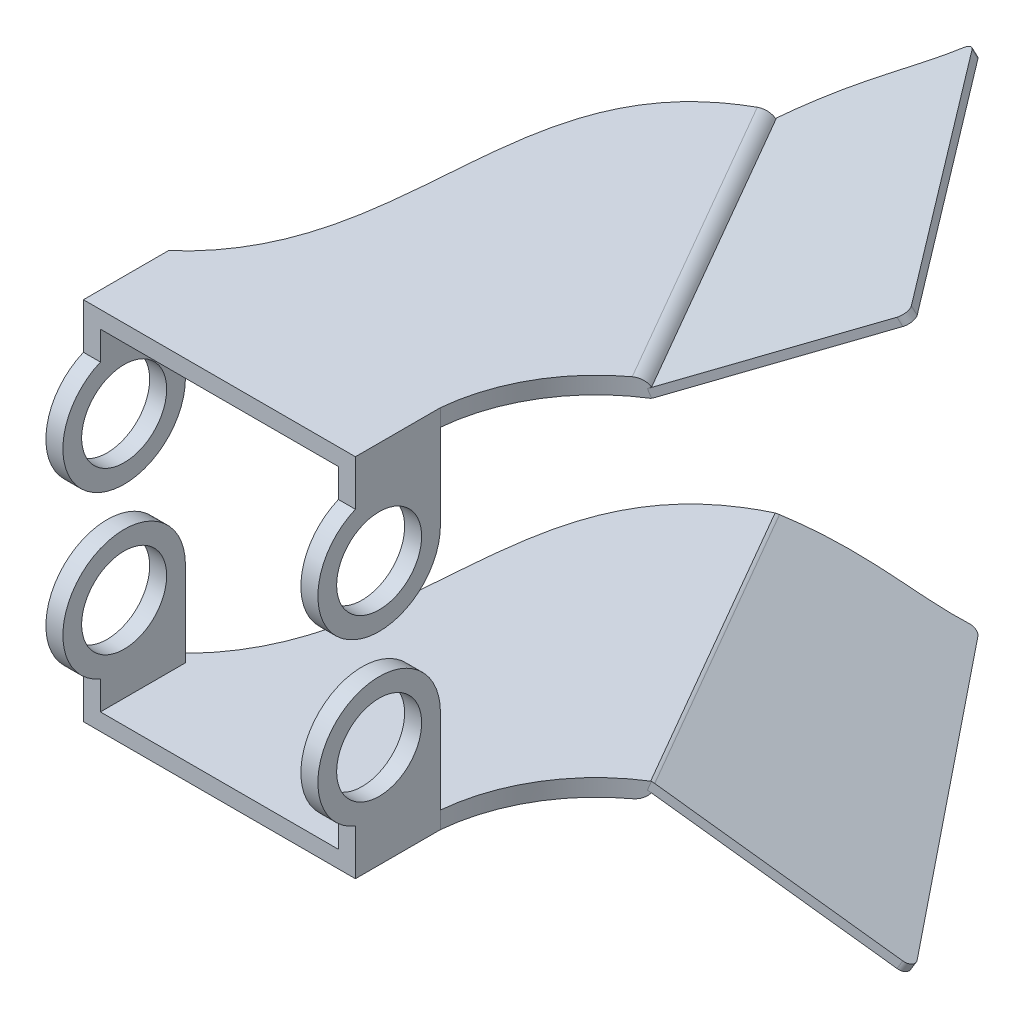
from build123d import *

# Parameters (mm, degrees)
EXTRUDE_1_DEPTH     = 2
SKETCH_2_R          = 5
EXTRUDE_2_DEPTH     = 16
SKETCH_6_W          = 28
SKETCH_6_H          = 17.402719954
CUT_EXTRUDE_1_DEPTH = 52.997949028
EXTRUDE_3_DEPTH     = 1
FILLET_2_R          = 2
FILLET_3_R          = 2
SKETCH_8_R          = 5.82594274
EXTRUDE_4_DEPTH     = 25
SKETCH_9_W          = 11.65188548
SKETCH_9_H          = 25
CUT_EXTRUDE_2_DEPTH = 22
SKETCH_11_R         = 5.664171458
EXTRUDE_5_DEPTH     = 40
SKETCH_12_W         = 11.328342916
SKETCH_12_H         = 39
CUT_EXTRUDE_3_DEPTH = 20
SKETCH_12_2_W       = 11.328342916
SKETCH_12_2_H       = 39
CUT_EXTRUDE_4_DEPTH = 10


with BuildPart() as part:
    # 草图1 → 凸台-拉伸1 (new body)
    with BuildSketch(Plane(origin=(0, 0, 0), x_dir=(1, 0, 0), z_dir=(0, 1, 0))):
        with BuildLine():
            Line((-33.243243243, -24.932432432), (-1.243243243, -24.932432432))
            Line((-1.243243243, -24.932432432), (-1.243243243, -14.932432432))
            ThreePointArc((-1.243243243, -14.932432432), (1.697148643, -6.13940818), (8.243243243, 0.426551416))
            Line((8.243243243, 0.426551416), (-11.756756757, 35.067567568))
            add(Edge.make_bspline(
                [(-33.243243243, -14.932432432), (-17.547932251, -1.015151266), (-32.626133519, 25.165131833), (-11.756756757, 35.067567568)],
                knots=[0, 0, 0, 0, 1, 1, 1, 1], degree=3))
            Line((-33.243243243, -14.932432432), (-33.243243243, -24.932432432))
        make_face()
    extrude(amount=EXTRUDE_1_DEPTH)

    # 草图2 → 凸台-拉伸2 (add, symmetric)
    with BuildSketch(Plane.ZY.offset(17.243243243)):
        with BuildLine():
            Line((14.932432432, 2), (14.932432432, 12))
            ThreePointArc((14.932432432, 12), (26.129367198, 18.003244699), (24.932432432, 5.355017858))
            Line((24.932432432, 5.355017858), (24.932432432, 2))
            Line((24.932432432, 2), (14.932432432, 2))
        make_face()
        with Locations((22.140221816, 12)):
            Circle(SKETCH_2_R, mode=Mode.SUBTRACT)
    extrude(amount=EXTRUDE_2_DEPTH, both=True)

    # 草图6 → 切除-拉伸1 (cut, through all)
    with BuildSketch(Plane.XY):
        with Locations((-17.243243243, 10.701359977)):
            Rectangle(SKETCH_6_W, SKETCH_6_H)
    extrude(amount=CUT_EXTRUDE_1_DEPTH, mode=Mode.SUBTRACT)

    # 草图7 → 凸台-拉伸3 (add)
    with BuildSketch(Plane(origin=(2.341783653, 4.683567307, -1.352029423), x_dir=(0.49999999999999495, 0, 0.8660254037844416), z_dir=(0.43301270189222174, 0.866025403784438, -0.24999999999999803))):
        with BuildLine():
            Line((-36.994807064, 25.214344641), (4.684167628, 32.070006247))
            ThreePointArc((4.684167628, 32.070006247), (5.524135177, 31.818639991), (5.843163839, 31.001969195))
            Line((5.843163839, 31.001969195), (3.752217259, 5.367134614))
            Line((3.752217259, 5.367134614), (3.752217259, 5.300961696))
            Line((3.752217259, 5.300961696), (-36.253180241, 5.300961696))
            Line((-36.253180241, 5.300961696), (-36.247782741, 5.367134614))
            add(Edge.make_bspline(
                [(-36.247782741, 5.367134614), (-38.690167695, 13.725474556), (-37.064789312, 18.95114602), (-37.821789964, 24.081635177)],
                knots=[0, 0, 0, 0, 0.95157929, 0.95157929, 0.95157929, 0.95157929], degree=3))
            ThreePointArc((-37.821789964, 24.081635177), (-37.640152143, 24.817264549), (-36.994807064, 25.214344641))
        make_face()
    extrude(amount=-EXTRUDE_3_DEPTH)

    # 圆角2
    # the kernel refuses this fillet: 2 mm, written as the material it takes off along each edge
    with BuildSketch(Plane(origin=(10.284484696, 0, 3.10898249), x_dir=(-0.8660254037844416, 0, 0.49999999999999495), z_dir=(-0.49999999999999495, 0, -0.8660254037844416))) as fillet_2_piece_1:
        with BuildLine():
            CenterArc((1.632993162, 2), FILLET_2_R, 215.264389683, 54.735610317)
            Line((0, 0.845299462), (-0.032659863, 0.822205451))
            ThreePointArc((-0.032659863, 0.822205451), (-0.04, 0.422649731), (-0.04, 0))
            Line((-0.04, 0), (0, -0.04))
            Line((0, -0.04), (1.632993162, -0.04))
            Line((1.632993162, -0.04), (1.632993162, 0))
        make_face()
    extrude(amount=48.164965809, mode=Mode.SUBTRACT)

    # 圆角3
    # the kernel refuses this fillet: 2 mm, written as the material it takes off along each edge
    with BuildSketch(Plane(origin=(8.679926515, 2.033086459, 0.444421053), x_dir=(0.7500000000000034, -0.499999999999998, -0.4330127018922155), z_dir=(-0.49999999999999495, 0, -0.8660254037844416))) as fillet_3_piece_1:
        with BuildLine():
            CenterArc((0.389050368, 2), FILLET_3_R, 258.783012488, 11.216987512)
            Line((0, 0.038204952), (-0.007781007, -0.001030949))
            ThreePointArc((-0.007781007, -0.001030949), (-0.04, 0.019102476), (-0.04, 0))
            Line((-0.04, 0), (0, -0.04))
            Line((0, -0.04), (0.389050368, -0.04))
            Line((0.389050368, -0.04), (0.389050368, 0))
        make_face()
    extrude(amount=41.950649342, mode=Mode.SUBTRACT)

    # 草图8 → 凸台-拉伸4 (add)
    with BuildSketch(Plane(origin=(0, 2, 0), x_dir=(1, 0, 0), z_dir=(0, 1, 0))):
        with Locations(Location((-15.759203843, -7.518855646, 0), (0, 0, 90))):
            Circle(SKETCH_8_R)
    extrude(amount=EXTRUDE_4_DEPTH)

    # 草图9 → 切除-拉伸2 (cut)
    with BuildSketch(Plane.XY):
        with Locations((-15.759203843, 14.5)):
            Rectangle(SKETCH_9_W, SKETCH_9_H)
    extrude(amount=CUT_EXTRUDE_2_DEPTH, mode=Mode.SUBTRACT)

    # 草图11 → 凸台-拉伸5 (add)
    with BuildSketch(Plane(origin=(0, 2, 0), x_dir=(1, 0, 0), z_dir=(0, 1, 0))):
        with Locations(Location((-15.437441139, -2.706519555, 0), (0, 0, 90))):
            Circle(SKETCH_11_R)
    extrude(amount=EXTRUDE_5_DEPTH)

    # 镜向1: part across plane


with BuildPart() as part_1:
    add(part.part)
    add(part.part.mirror(Plane.ZX.offset(21.5)))

    # 草图12 → 切除-拉伸3 (cut)
    with BuildSketch(Plane.XY):
        with Locations((-15.437441139, 21.5)):
            Rectangle(SKETCH_12_W, SKETCH_12_H)
    extrude(amount=CUT_EXTRUDE_3_DEPTH, mode=Mode.SUBTRACT)

    # 草图12<2> → 切除-拉伸4 (cut)
    with BuildSketch(Plane.XY):
        with Locations((-15.437441139, 21.5)):
            Rectangle(SKETCH_12_2_W, SKETCH_12_2_H)
    extrude(amount=-CUT_EXTRUDE_4_DEPTH, mode=Mode.SUBTRACT)


with BuildPart() as cut_extrude_4_piece_1:
    # of the separate pieces the step leaves, piece 1, a body of its own (cut_extrude_4_pieces)
    add(part_1.part.solids().sort_by_distance((-33.243243243, 5.355017858, 24.932432432))[0])


with BuildPart() as cut_extrude_4_piece_2:
    # of the separate pieces the step leaves, piece 2, a body of its own (cut_extrude_4_pieces)
    add(part_1.part.solids().sort_by_distance((-3.243243243, 41, 14.932432432))[0])


solid = Compound([cut_extrude_4_piece_1.part, cut_extrude_4_piece_2.part])
